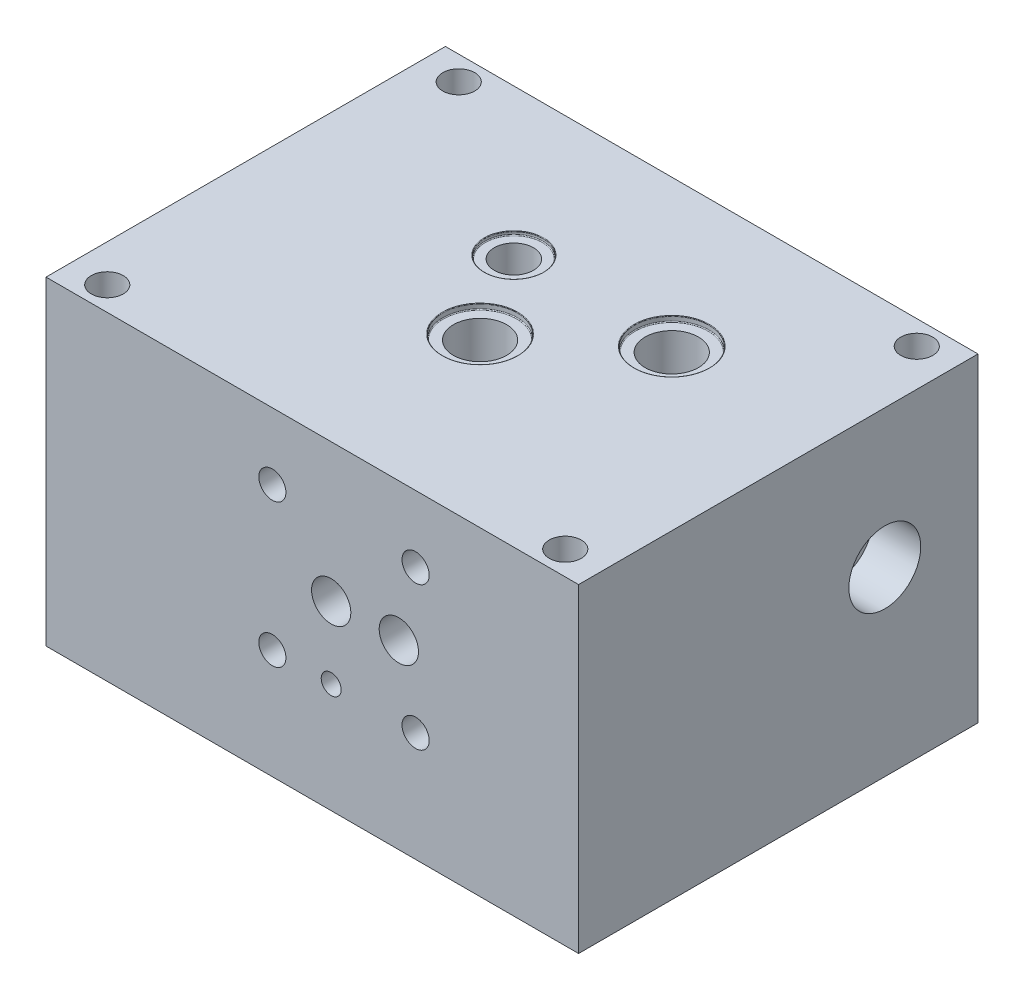
from build123d import *

# Parameters (mm, degrees)
SKETCH_1_W                      = 200
SKETCH_1_H                      = 150
EXTRUDE_1_DEPTH                 = 120
SKETCH_3_R                      = 10
CUT_EXTRUDE_1_DEPTH             = 200
SKETCH_4_R                      = 10
CUT_EXTRUDE_2_DEPTH             = 200
SKETCH_9_R                      = 5
CUT_EXTRUDE_5_DEPTH             = 45
HOLE_WIZARD_M10_2_D             = 8.5
HOLE_WIZARD_M10_2_DEPTH         = 24.5
HOLE_WIZARD_M10_2_TIP           = 2.553657631
SKETCH_11_R                     = 5
SKETCH_11_R_2                   = 7.35
SKETCH_11_R_3                   = 3.5
CUT_EXTRUDE_7_DEPTH             = 1
HOLE_WIZARD_M12_2_D             = 10.2
HOLE_WIZARD_M12_2_DEPTH         = 29.25
HOLE_WIZARD_M12_2_TIP           = 3.064389157
HOLE_WIZARD_14_75_14_75_2_D     = 14.75
HOLE_WIZARD_14_75_14_75_2_DEPTH = 63
HOLE_WIZARD_14_75_14_75_2_TIP   = 4.431347065
HOLE_WIZARD_14_75_14_75_4_D     = 14.75
HOLE_WIZARD_14_75_14_75_4_DEPTH = 95
HOLE_WIZARD_14_75_14_75_4_TIP   = 4.431347065
SKETCH_27_R                     = 4
SKETCH_27_R_2                   = 7.35
SKETCH_27_R_3                   = 3.75
CUT_EXTRUDE_8_DEPTH             = 0.01
HOLE_WIZARD_7_5_7_5_2_D         = 7.5
HOLE_WIZARD_7_5_7_5_2_DEPTH     = 10
HOLE_WIZARD_7_5_7_5_2_TIP       = 2.253227321
HOLE_WIZARD_4_8_4_8_1_D         = 4.8
HOLE_WIZARD_4_8_4_8_1_DEPTH     = 130
HOLE_WIZARD_4_8_4_8_1_TIP       = 1.442065486
HOLE_WIZARD_10_0_10_1_D         = 10
HOLE_WIZARD_10_0_10_1_DEPTH     = 100
HOLE_WIZARD_10_0_10_1_TIP       = 3.004303095
SKETCH_27_2_R                   = 7.35
CUT_EXTRUDE_9_DEPTH             = 0.2
HOLE_WIZARD_14_75_14_75_8_D     = 14.75
HOLE_WIZARD_14_75_14_75_8_DEPTH = 54
HOLE_WIZARD_14_75_14_75_8_TIP   = 4.431347065
SKETCH_27_3_R                   = 7.35
CUT_EXTRUDE_10_DEPTH            = 55
SKETCH_46_R                     = 7.35
CUT_EXTRUDE_12_DEPTH            = 1
HOLE_WIZARD_14_75_14_75_9_D     = 14.75
HOLE_WIZARD_14_75_14_75_9_DEPTH = 62
HOLE_WIZARD_14_75_14_75_9_TIP   = 4.431347065
HOLE_WIZARD_7_5_7_5_1_D         = 7.5
HOLE_WIZARD_7_5_7_5_1_DEPTH     = 10
HOLE_WIZARD_7_5_7_5_1_TIP       = 2.253227321
SKETCH_49_R                     = 13.5
CUT_EXTRUDE_13_DEPTH            = 18
HOLE_WIZARD_10_0_10_2_D         = 10
HOLE_WIZARD_10_0_10_2_DEPTH     = 100
HOLE_WIZARD_10_0_10_2_TIP       = 3.004303095
SKETCH_54_R                     = 14
CUT_EXTRUDE_15_DEPTH            = 1.97
SKETCH_55_R                     = 11
CUT_EXTRUDE_16_DEPTH            = 1.28
FILLET_2_R                      = 0.3
FILLET_3_R                      = 0.2
SKETCH_58_R                     = 6
CUT_EXTRUDE_17_DEPTH            = 174.277234682


# Read off the part's stored shape, not the designer's step: M10 螺纹孔3
with BuildPart() as part:
    # 草图1 → 凸台-拉伸1 (new body)
    with BuildSketch(Plane(origin=(0, 0, 0), x_dir=(1, 0, 0), z_dir=(0, 1, 0))):
        Rectangle(SKETCH_1_W, SKETCH_1_H)
    extrude(amount=EXTRUDE_1_DEPTH)

    # 草图3 → 切除-拉伸1 (cut)
    with BuildSketch(Plane(origin=(0, 120, 0), x_dir=(1, 0, 0), z_dir=(0, 1, 0))):
        with Locations(Location((40, 20, 0), (0, 0, 270))):
            Circle(SKETCH_3_R)
    extrude(amount=-CUT_EXTRUDE_1_DEPTH, mode=Mode.SUBTRACT)

    # 草图4 → 切除-拉伸2 (cut)
    with BuildSketch(Plane(origin=(0, 120, 0), x_dir=(1, 0, 0), z_dir=(0, 1, 0))):
        with Locations(Location((0, -12, 0), (0, 0, 270))):
            Circle(SKETCH_4_R)
    extrude(amount=-CUT_EXTRUDE_2_DEPTH, mode=Mode.SUBTRACT)

    # 草图9 → 切除-拉伸5 (cut)
    with BuildSketch(Plane.ZY.offset(100)):
        with Locations((-26.9, 66.7)):
            Circle(SKETCH_9_R)
    extrude(amount=-CUT_EXTRUDE_5_DEPTH, mode=Mode.SUBTRACT)

    # M10 螺纹孔2
    with Locations(Plane(origin=(-100, 100, -34), x_dir=(0, 0, -1), z_dir=(-1, 0, 0))):
        with Locations((0, 0), (-42.9, 0), (-42.9, 66.7), (0, 66.7)):
            Hole(HOLE_WIZARD_M10_2_D / 2, depth=HOLE_WIZARD_M10_2_DEPTH)
            with Locations((0, 0, -(HOLE_WIZARD_M10_2_DEPTH + HOLE_WIZARD_M10_2_TIP / 2))):  # 118° drill point
                Cone(0, HOLE_WIZARD_M10_2_D / 2, HOLE_WIZARD_M10_2_TIP, mode=Mode.SUBTRACT)

    # 草图11 → 切除-拉伸7 (cut)
    with BuildSketch(Plane.XY.offset(75)):
        with Locations((-15, 95)):
            Circle(SKETCH_11_R)
        with Locations((38.8, 95)):
            Circle(SKETCH_11_R)
        with Locations((-15, 41.2)):
            Circle(SKETCH_11_R)
        with Locations((38.8, 41.2)):
            Circle(SKETCH_11_R)
        with Locations((7.1, 68.1)):
            Circle(SKETCH_11_R_2)
        with Locations((32.5, 68.1)):
            Circle(SKETCH_11_R_2)
        with Locations((7.1, 41.2)):
            Circle(SKETCH_11_R_3)
    extrude(amount=-CUT_EXTRUDE_7_DEPTH, mode=Mode.SUBTRACT)

    # M12 螺纹孔2
    with Locations(Plane(origin=(-15, 95, 75), x_dir=(1, 0, 0), z_dir=(0, 0, 1))):
        with Locations((0, 0), (0, -53.8), (53.8, -53.8), (53.8, 0)):
            Hole(HOLE_WIZARD_M12_2_D / 2, depth=HOLE_WIZARD_M12_2_DEPTH)
            with Locations((0, 0, -(HOLE_WIZARD_M12_2_DEPTH + HOLE_WIZARD_M12_2_TIP / 2))):  # 118° drill point
                Cone(0, HOLE_WIZARD_M12_2_D / 2, HOLE_WIZARD_M12_2_TIP, mode=Mode.SUBTRACT)

    # Ø14.75 (14.75) 直径孔2
    with Locations(Plane(origin=(7.1, 68.1, 75), x_dir=(1, 0, 0), z_dir=(0, 0, 1))):
        with Locations((0, 0)):
            Hole(HOLE_WIZARD_14_75_14_75_2_D / 2, depth=HOLE_WIZARD_14_75_14_75_2_DEPTH)
            with Locations((0, 0, -(HOLE_WIZARD_14_75_14_75_2_DEPTH + HOLE_WIZARD_14_75_14_75_2_TIP / 2))):  # 118° drill point
                Cone(0, HOLE_WIZARD_14_75_14_75_2_D / 2, HOLE_WIZARD_14_75_14_75_2_TIP, mode=Mode.SUBTRACT)

    # Ø14.75 (14.75) 直径孔4
    with Locations(Plane(origin=(32.5, 68.1, 75), x_dir=(1, 0, 0), z_dir=(0, 0, 1))):
        with Locations((0, 0)):
            Hole(HOLE_WIZARD_14_75_14_75_4_D / 2, depth=HOLE_WIZARD_14_75_14_75_4_DEPTH)
            with Locations((0, 0, -(HOLE_WIZARD_14_75_14_75_4_DEPTH + HOLE_WIZARD_14_75_14_75_4_TIP / 2))):  # 118° drill point
                Cone(0, HOLE_WIZARD_14_75_14_75_4_D / 2, HOLE_WIZARD_14_75_14_75_4_TIP, mode=Mode.SUBTRACT)

    # 草图27 → 切除-拉伸8 (cut)
    with BuildSketch(Plane(origin=(0, 0, -75), x_dir=(-1, 0, 0), z_dir=(0, 0, -1))):
        with Locations((55, 33.4)):
            Circle(SKETCH_27_R)
        with Locations((12.1, 33.4)):
            Circle(SKETCH_27_R)
        with Locations((55, 100.1)):
            Circle(SKETCH_27_R)
        with Locations((12.1, 100.1)):
            Circle(SKETCH_27_R)
        with Locations((47.3, 66.7)):
            Circle(SKETCH_27_R_2)
        with Locations((19.3, 66.7)):
            Circle(SKETCH_27_R_2)
        with Locations((23.2, 100.1)):
            Circle(SKETCH_27_R_3)
    extrude(amount=-CUT_EXTRUDE_8_DEPTH, mode=Mode.SUBTRACT)

    # M10 螺纹孔3 outline → M10 螺纹孔3 (revolve, cut)
    with BuildSketch(Plane(origin=(-12.1, 33.4, 0), x_dir=(1, 0, 0), z_dir=(0, -1, 0))):
        Polygon((0, -47.946342369), (0, -74.99), (4, -74.99), (4, -75), (4.25, -75), (4.25, -50.5), align=None)
    revolve(axis=Axis((-12.1, 33.4, 0), (0, 0, 1)), mode=Mode.SUBTRACT)

    # Hole Wizard M10 _3 2 outline → Hole Wizard M10 _3 2 (revolve, cut)
    with BuildSketch(Plane(origin=(-55, 100.1, 0), x_dir=(1, 0, 0), z_dir=(0, -1, 0))):
        Polygon((0, -74.99), (4.25, -74.99), (4.25, -50.49), (0, -47.936342369), align=None)
    revolve(axis=Axis((-55, 100.1, 0), (0, 0, 1)), mode=Mode.SUBTRACT)

    # Hole Wizard M10 _3 3 outline → Hole Wizard M10 _3 3 (revolve, cut)
    with BuildSketch(Plane(origin=(-55, 33.4, 0), x_dir=(1, 0, 0), z_dir=(0, -1, 0))):
        Polygon((0, -47.946342369), (0, -74.99), (4, -74.99), (4, -75), (4.25, -75), (4.25, -50.5), align=None)
    revolve(axis=Axis((-55, 33.4, 0), (0, 0, 1)), mode=Mode.SUBTRACT)

    # Hole Wizard M10 _3 4 outline → Hole Wizard M10 _3 4 (revolve, cut)
    with BuildSketch(Plane(origin=(-12.1, 100.1, 0), x_dir=(1, 0, 0), z_dir=(0, -1, 0))):
        Polygon((0, -47.946342369), (0, -74.99), (4, -74.99), (4, -75), (4.25, -75), (4.25, -50.5), align=None)
    revolve(axis=Axis((-12.1, 100.1, 0), (0, 0, 1)), mode=Mode.SUBTRACT)

    # Ø7.5 (7.5) 直径孔2
    with Locations(Plane(origin=(-23.2, 100.1, -74.99), x_dir=(-1, 0, 0), z_dir=(0, 0, -1))):
        with Locations((0, 0)):
            Hole(HOLE_WIZARD_7_5_7_5_2_D / 2, depth=HOLE_WIZARD_7_5_7_5_2_DEPTH)
            with Locations((0, 0, -(HOLE_WIZARD_7_5_7_5_2_DEPTH + HOLE_WIZARD_7_5_7_5_2_TIP / 2))):  # 118° drill point
                Cone(0, HOLE_WIZARD_7_5_7_5_2_D / 2, HOLE_WIZARD_7_5_7_5_2_TIP, mode=Mode.SUBTRACT)

    # Ø4.8 (4.8) 直径孔1
    with Locations(Plane(origin=(-100, 41.2, -12.6), x_dir=(0, 0, -1), z_dir=(-1, 0, 0))):
        with Locations((0, 0)):
            Hole(HOLE_WIZARD_4_8_4_8_1_D / 2, depth=HOLE_WIZARD_4_8_4_8_1_DEPTH)
            with Locations((0, 0, -(HOLE_WIZARD_4_8_4_8_1_DEPTH + HOLE_WIZARD_4_8_4_8_1_TIP / 2))):  # 118° drill point
                Cone(0, HOLE_WIZARD_4_8_4_8_1_D / 2, HOLE_WIZARD_4_8_4_8_1_TIP, mode=Mode.SUBTRACT)

    # Ø10.0 (10) 直径孔1
    with Locations(Plane.ZY.offset(100)):
        with Locations((1.7, 66.7)):
            Hole(HOLE_WIZARD_10_0_10_1_D / 2, depth=HOLE_WIZARD_10_0_10_1_DEPTH)
            with Locations((0, 0, -(HOLE_WIZARD_10_0_10_1_DEPTH + HOLE_WIZARD_10_0_10_1_TIP / 2))):  # 118° drill point
                Cone(0, HOLE_WIZARD_10_0_10_1_D / 2, HOLE_WIZARD_10_0_10_1_TIP, mode=Mode.SUBTRACT)

    # 草图27<2> → 切除-拉伸9 (cut)
    with BuildSketch(Plane(origin=(0, 0, -75), x_dir=(-1, 0, 0), z_dir=(0, 0, -1))):
        with Locations((47.3, 66.7)):
            Circle(SKETCH_27_2_R)
    extrude(amount=-CUT_EXTRUDE_9_DEPTH, mode=Mode.SUBTRACT)

    # Ø14.75 (14.75) 直径孔8
    with Locations(Plane(origin=(0, 0, -75), x_dir=(-1, 0, 0), z_dir=(0, 0, -1))):
        with Locations((47.3, 66.7)):
            Hole(HOLE_WIZARD_14_75_14_75_8_D / 2, depth=HOLE_WIZARD_14_75_14_75_8_DEPTH)
            with Locations((0, 0, -(HOLE_WIZARD_14_75_14_75_8_DEPTH + HOLE_WIZARD_14_75_14_75_8_TIP / 2))):  # 118° drill point
                Cone(0, HOLE_WIZARD_14_75_14_75_8_D / 2, HOLE_WIZARD_14_75_14_75_8_TIP, mode=Mode.SUBTRACT)

    # 草图27<3> → 切除-拉伸10 (cut)
    with BuildSketch(Plane(origin=(0, 0, -75), x_dir=(-1, 0, 0), z_dir=(0, 0, -1))):
        with Locations((19.3, 66.7)):
            Circle(SKETCH_27_3_R)
    extrude(amount=-CUT_EXTRUDE_10_DEPTH, mode=Mode.SUBTRACT)

    # 草图46 → 切除-拉伸12 (cut)
    with BuildSketch(Plane(origin=(0, 120, 0), x_dir=(1, 0, 0), z_dir=(0, 1, 0))):
        with Locations(Location((-19.3, 20, 0), (0, 0, 270))):
            Circle(SKETCH_46_R)
    extrude(amount=-CUT_EXTRUDE_12_DEPTH, mode=Mode.SUBTRACT)

    # Ø14.75 (14.75) 直径孔9
    with Locations(Plane(origin=(-19.3, 120, -20), x_dir=(0, 0, 1), z_dir=(0, 1, 0))):
        with Locations((0, 0)):
            Hole(HOLE_WIZARD_14_75_14_75_9_D / 2, depth=HOLE_WIZARD_14_75_14_75_9_DEPTH)
            with Locations((0, 0, -(HOLE_WIZARD_14_75_14_75_9_DEPTH + HOLE_WIZARD_14_75_14_75_9_TIP / 2))):  # 118° drill point
                Cone(0, HOLE_WIZARD_14_75_14_75_9_D / 2, HOLE_WIZARD_14_75_14_75_9_TIP, mode=Mode.SUBTRACT)

    # Ø7.5 (7.5) 直径孔1
    with Locations(Plane(origin=(7.1, 41.2, 75), x_dir=(1, 0, 0), z_dir=(0, 0, 1))):
        with Locations((0, 0)):
            Hole(HOLE_WIZARD_7_5_7_5_1_D / 2, depth=HOLE_WIZARD_7_5_7_5_1_DEPTH)
            with Locations((0, 0, -(HOLE_WIZARD_7_5_7_5_1_DEPTH + HOLE_WIZARD_7_5_7_5_1_TIP / 2))):  # 118° drill point
                Cone(0, HOLE_WIZARD_7_5_7_5_1_D / 2, HOLE_WIZARD_7_5_7_5_1_TIP, mode=Mode.SUBTRACT)

    # 草图49 → 切除-拉伸13 (cut)
    with BuildSketch(Plane(origin=(100, 0, 0), x_dir=(0, 0, -1), z_dir=(1, 0, 0))):
        with Locations((40, 68.1)):
            Circle(SKETCH_49_R)
    extrude(amount=-CUT_EXTRUDE_13_DEPTH, mode=Mode.SUBTRACT)

    # Ø10.0 (10) 直径孔2
    with Locations(Plane(origin=(82, 68.1, -40), x_dir=(0, 0, 1), z_dir=(1, 0, 0))):
        with Locations((0, 0)):
            Hole(HOLE_WIZARD_10_0_10_2_D / 2, depth=HOLE_WIZARD_10_0_10_2_DEPTH)
            with Locations((0, 0, -(HOLE_WIZARD_10_0_10_2_DEPTH + HOLE_WIZARD_10_0_10_2_TIP / 2))):  # 118° drill point
                Cone(0, HOLE_WIZARD_10_0_10_2_D / 2, HOLE_WIZARD_10_0_10_2_TIP, mode=Mode.SUBTRACT)

    # 草图54 → 切除-拉伸15 (cut)
    with BuildSketch(Plane(origin=(0, 120, 0), x_dir=(1, 0, 0), z_dir=(0, 1, 0))):
        with Locations(Location((0, -12, 0), (0, 0, 270))):
            Circle(SKETCH_54_R)
        with Locations(Location((40, 20, 0), (0, 0, 270))):
            Circle(SKETCH_54_R)
    extrude(amount=-CUT_EXTRUDE_15_DEPTH, mode=Mode.SUBTRACT)

    # 草图55 → 切除-拉伸16 (cut)
    with BuildSketch(Plane(origin=(0, 120, 0), x_dir=(1, 0, 0), z_dir=(0, 1, 0))):
        with Locations(Location((-19.3, 20, 0), (0, 0, 270))):
            Circle(SKETCH_55_R)
    extrude(amount=-CUT_EXTRUDE_16_DEPTH, mode=Mode.SUBTRACT)

    # 圆角2
    fillet_2_edges = [part.edges().sort_by_distance(p)[0] for p in [
        (0, 118.03, -2),
        (40, 118.03, -34),
        (-19.3, 118.72, -31),
    ]]
    fillet(fillet_2_edges, radius=FILLET_2_R)

    # 圆角3
    fillet_3_edges = [part.edges().sort_by_distance(p)[0] for p in [
        (0, 120, -2),
        (40, 120, -34),
        (-19.3, 120, -31),
    ]]
    fillet(fillet_3_edges, radius=FILLET_3_R)

    # 草图58 → 切除-拉伸17 (cut, through all)
    with BuildSketch(Plane(origin=(0, 120, 0), x_dir=(1, 0, 0), z_dir=(0, 1, 0))):
        with Locations(Location((-86, 66, 0), (0, 0, 270))):
            Circle(SKETCH_58_R)
        with Locations(Location((86, 66, 0), (0, 0, 90))):
            Circle(SKETCH_58_R)
        with Locations(Location((-86, -66, 0), (0, 0, 90))):
            Circle(SKETCH_58_R)
        with Locations(Location((86, -66, 0), (0, 0, 270))):
            Circle(SKETCH_58_R)
    extrude(amount=-CUT_EXTRUDE_17_DEPTH, mode=Mode.SUBTRACT)


solid = part.part
